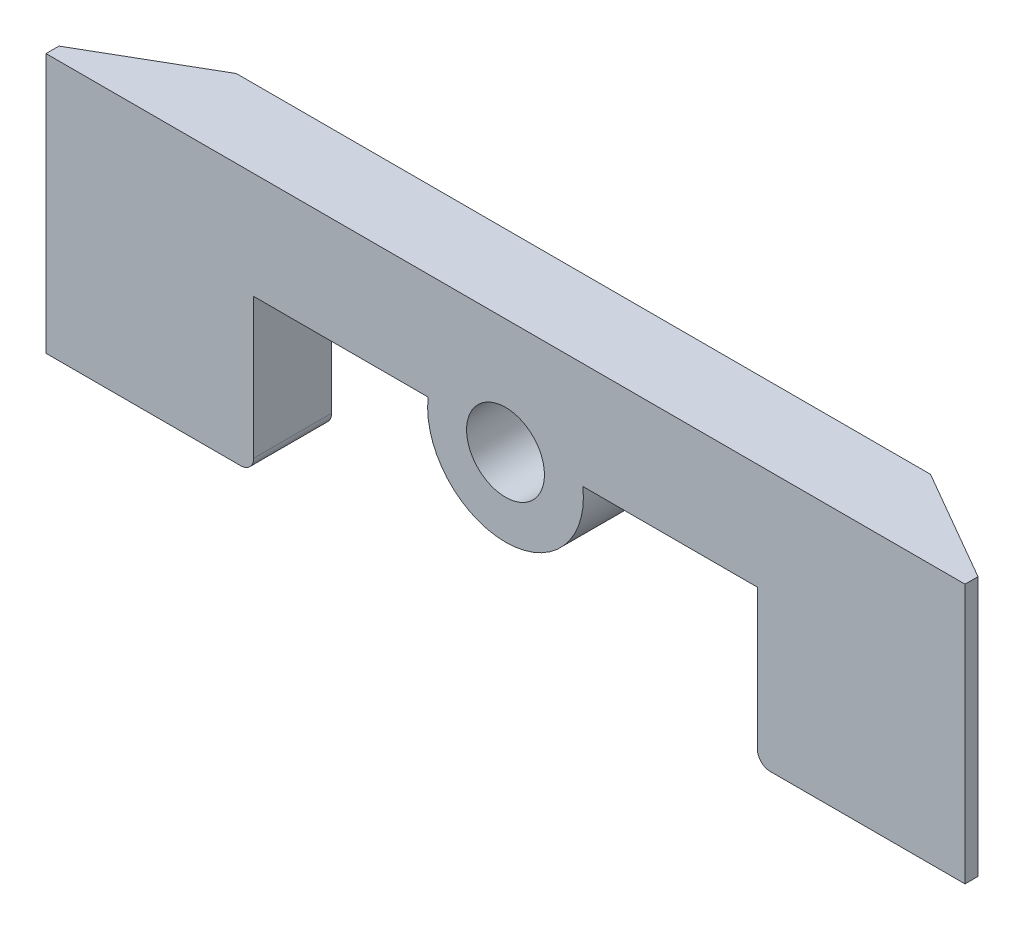
from build123d import *

# Parameters (mm, degrees)
SKETCH2_R           = 1.5
BOSS_EXTRUDE2_DEPTH = 3
FILLET1_R           = 2.5
CUT_EXTRUDE1_DEPTH  = 20
FILLET2_R           = 0.5


with BuildPart() as part:
    # Sketch2 → Boss-Extrude2 (new body)
    with BuildSketch(Plane.XY):
        with BuildLine():
            Line((9.7, 0.9), (9.7, -5))
            Line((9.7, -5), (17.7, -5))
            Line((17.7, -5), (17.7, 5))
            Line((17.7, 5), (-17.7, 5))
            Line((-17.7, 5), (-17.7, -5))
            Line((-17.7, -5), (-9.7, -5))
            Line((-9.7, -5), (-9.7, 0.9))
            Line((-9.7, 0.9), (-2.979513383, 0.9))
            ThreePointArc((-2.979513383, 0.9), (0, -2.45), (2.979513383, 0.9))
            Line((2.979513383, 0.9), (9.7, 0.9))
        make_face()
        with Locations((0, 0.55)):
            Circle(SKETCH2_R, mode=Mode.SUBTRACT)
    extrude(amount=BOSS_EXTRUDE2_DEPTH)

    # Fillet1
    fillet1_edges = [part.edges().sort_by_distance(p)[0] for p in [
        (-6.339756692, 0.9, 0),
        (6.339756692, 0.9, 0),
    ]]
    fillet(fillet1_edges, radius=FILLET1_R)

    # Sketch4 → Cut-Extrude1 (cut)
    with BuildSketch(Plane(origin=(0, 5, 0), x_dir=(1, 0, 0), z_dir=(0, 1, 0))):
        Polygon((-13.369872981, 0), (-17.7, 0), (-17.7, -2.5), align=None)
        Polygon((17.7, 0), (13.369872981, 0), (17.7, -2.5), align=None)
    extrude(amount=-CUT_EXTRUDE1_DEPTH, mode=Mode.SUBTRACT)

    # Fillet2
    fillet2_edges = [part.edges().sort_by_distance(p)[0] for p in [
        (9.7, -5, 1.5),
        (-9.7, -5, 1.5),
    ]]
    fillet(fillet2_edges, radius=FILLET2_R)


solid = part.part
